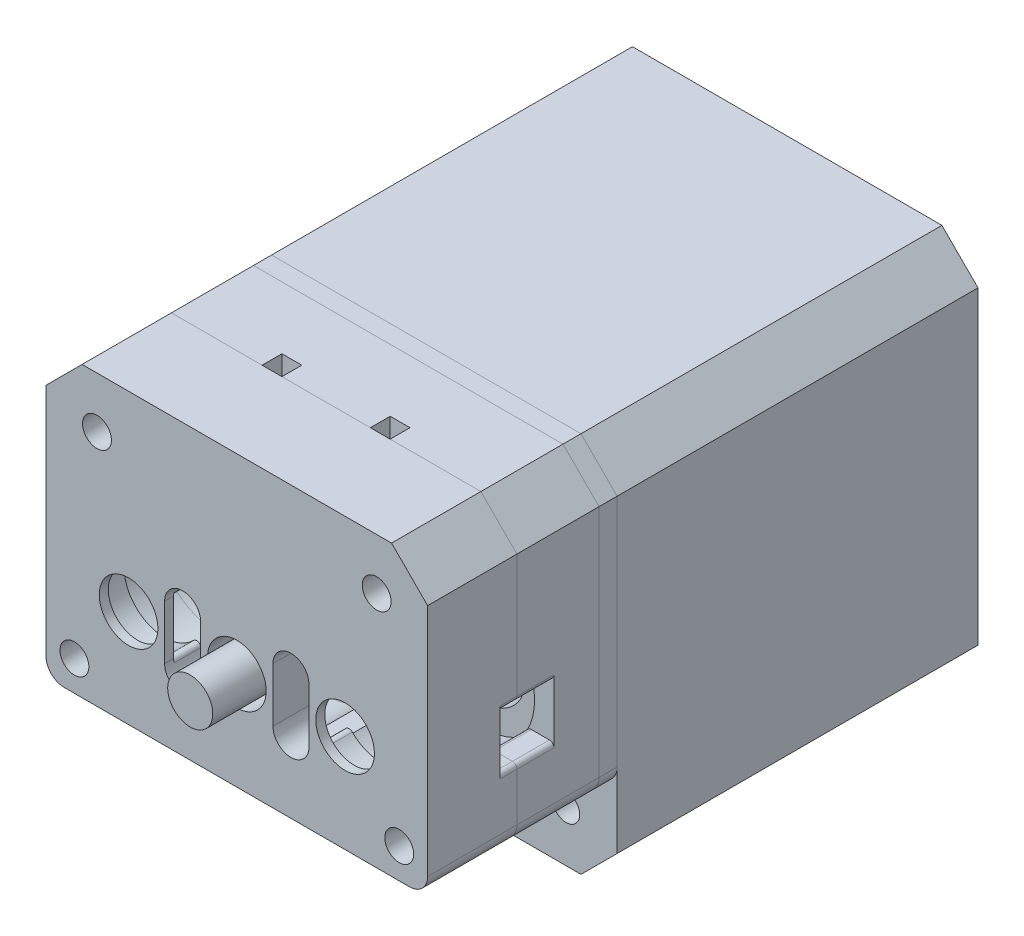
from build123d import *

# Parameters (mm, degrees)
SKETCH1_W                = 42.3
SKETCH1_H                = 42.3
BOSS_EXTRUDE1_DEPTH      = 40
CHAMFER1_SIZE            = 4
SKETCH3_R                = 1.5
CUT_EXTRUDE1_DEPTH       = 5
BOSS_EXTRUDE2_DEPTH      = 2
BOSS_EXTRUDE4_DEPTH      = 19
SKETCH6_R                = 2.5
BOSS_EXTRUDE3_DEPTH      = 19
SKETCH7_R                = 1.6
CUT_EXTRUDE2_DEPTH       = 68.938538401
SKETCH8_W                = 2.2
SKETCH8_H                = 2.2
CUT_EXTRUDE3_DEPTH       = 62.940394736
CUT_EXTRUDE4_DEPTH       = 68.938538401
SKETCH10_R               = 7
CUT_EXTRUDE5_DEPTH       = 68.938538401
CUT_EXTRUDE7_DEPTH       = 15.5
FILLET1_R                = 0.5
SKETCH14_R               = 3.25
CUT_EXTRUDE8_DEPTH       = 55.450849396
SKETCH17_R               = 1.6
CUT_EXTRUDE11_DEPTH      = 9.9
SKETCH47_R               = 1.25
CUT_EXTRUDE27_DEPTH      = 60.210260935
SURFACE_EXTRUDE2_1_BACK  = 25
SURFACE_EXTRUDE2_1_DEPTH = 25
CUT_EXTRUDE24_DEPTH      = 3
SKETCH36_W               = 12
SKETCH36_H               = 7.6
SKETCH36_W_2             = 2.2
SKETCH36_H_2             = 2.2
BOSS_EXTRUDE9_DEPTH      = 2
SKETCH39_W               = 2.2
SKETCH39_H               = 2.2
BOSS_EXTRUDE10_DEPTH     = 2
SKETCH37_R               = 7
CUT_EXTRUDE20_DEPTH      = 55.450849396
SKETCH38_R               = 7
CUT_EXTRUDE21_DEPTH      = 7.6
FILLET10_R               = 1
FILLET11_R               = 0.5
SKETCH40_W               = 6
SKETCH40_H               = 6
CUT_EXTRUDE22_DEPTH      = 5
BOSS_EXTRUDE12_DEPTH     = 7.9
FILLET12_R               = 0.5
BOSS_EXTRUDE13_START     = -4
BOSS_EXTRUDE13_OUTLINE_R = 3.25
BOSS_EXTRUDE13_DEPTH     = 4
SKETCH45_R               = 4.5
CUT_EXTRUDE25_DEPTH      = 3
FILLET14_R               = 0.5
SKETCH46_R               = 3.25
CUT_EXTRUDE26_DEPTH      = 68.938538401
FILLET15_R               = 2
SKETCH49_R               = 1.5
CUT_EXTRUDE28_DEPTH      = 9.1
SKETCH50_R               = 1.6
BOSS_EXTRUDE14_DEPTH     = 2
FILLET16_R               = 0.5
SKETCH51_R               = 1.4
BOSS_EXTRUDE15_DEPTH     = 3


with BuildPart() as part:
    # Sketch1 → Boss-Extrude1 (new body)
    with BuildSketch(Plane.XY):
        Rectangle(SKETCH1_W, SKETCH1_H)
    extrude(amount=-BOSS_EXTRUDE1_DEPTH)

    # Sketch2 → Revolve1 (revolve)
    with BuildSketch(Plane(origin=(0, 0, 0), x_dir=(1, 0, 0), z_dir=(0, 1, 0)), mode=Mode.PRIVATE) as revolve1_sk:
        Polygon((11, -2), (2.5, -2), (2.5, -26.163724733), (0, -26.163724733), (0, 0), (11, 0), align=None)
    revolve(revolve1_sk.sketch.rotate(Axis((0, 0, 0), (0, 0, 1)), 180), axis=Axis((0, 0, 0), (0, 0, 1)))

    # Chamfer1
    chamfer1_edges = [part.edges().sort_by_distance(p)[0] for p in [
        (-21.15, 21.15, -20),
        (21.15, 21.15, -20),
        (21.15, -21.15, -20),
        (-21.15, -21.15, -20),
    ]]
    chamfer(chamfer1_edges, length=CHAMFER1_SIZE)

    # Sketch3 → Cut-Extrude1 (cut)
    with BuildSketch(Plane.XY):
        with Locations((-15.5, 15.5)):
            Circle(SKETCH3_R)
        with Locations((15.5, 15.5)):
            Circle(SKETCH3_R)
        with Locations((15.5, -15.5)):
            Circle(SKETCH3_R)
        with Locations((-15.5, -15.5)):
            Circle(SKETCH3_R)
    extrude(amount=-CUT_EXTRUDE1_DEPTH, mode=Mode.SUBTRACT)


with BuildPart() as body_2:
    # Sketch5 → Boss-Extrude2 (new body)
    with BuildSketch(Plane.XY):
        with BuildLine():
            Line((-21.15, -10.85), (-2.342541355, -10.85))
            ThreePointArc((-2.342541355, -10.85), (0, 11.1), (2.342541355, -10.85))
            Line((2.342541355, -10.85), (21.15, -10.85))
            Line((21.15, -10.85), (21.15, 17.15))
            Line((21.15, 17.15), (17.15, 21.15))
            Line((17.15, 21.15), (-17.15, 21.15))
            Line((-17.15, 21.15), (-21.15, 17.15))
            Line((-21.15, 17.15), (-21.15, -10.85))
        make_face()
    extrude(amount=BOSS_EXTRUDE2_DEPTH)


with BuildPart() as body_3:
    # Sketch20 → Boss-Extrude4 (new body)
    with BuildSketch(Plane.XY.offset(2)):
        with BuildLine():
            Line((21.15, 17.15), (17.15, 21.15))
            Line((17.15, 21.15), (-17.15, 21.15))
            Line((-17.15, 21.15), (-21.15, 17.15))
            Line((-21.15, 17.15), (-21.15, -10.85))
            Line((-21.15, -10.85), (-2.342541355, -10.85))
            ThreePointArc((-2.342541355, -10.85), (0, 11.1), (2.342541355, -10.85))
            Line((2.342541355, -10.85), (21.15, -10.85))
            Line((21.15, -10.85), (21.15, 17.15))
        make_face()
    extrude(amount=BOSS_EXTRUDE4_DEPTH)

    # Sketch6 → Boss-Extrude3 (add)
    with BuildSketch(Plane.XY.offset(21)):
        with BuildLine():
            Line((-2.342541355, -10.85), (2.342541355, -10.85))
            ThreePointArc((2.342541355, -10.85), (0, 11.1), (-2.342541355, -10.85))
        make_face()
        with Locations(Location((0, 0, 0), (0, 0, 180))):
            Circle(SKETCH6_R, mode=Mode.SUBTRACT)
    extrude(amount=-BOSS_EXTRUDE3_DEPTH)


with BuildPart() as cut_extrude2_tool:
    # Sketch7 → Cut-Extrude2 (new, through all)
    with BuildSketch(Plane.XY.offset(21)):
        with Locations((15.5, 15.5)):
            Circle(SKETCH7_R)
    extrude(amount=-CUT_EXTRUDE2_DEPTH)


with BuildPart() as body_2_1:
    add(body_2.part)

    # Cut-Extrude2: cut by cut_extrude2_tool
    add(cut_extrude2_tool.part, mode=Mode.SUBTRACT)


with BuildPart() as body_3_1:
    add(body_3.part)

    # Cut-Extrude2: cut by cut_extrude2_tool
    add(cut_extrude2_tool.part, mode=Mode.SUBTRACT)

    # Sketch8 → Cut-Extrude3 (cut, through all)
    with BuildSketch(Plane(origin=(0, 21.15, 0), x_dir=(1, 0, 0), z_dir=(0, 1, 0))):
        with Locations((6, -10)):
            Rectangle(SKETCH8_W, SKETCH8_H)
    extrude(amount=-CUT_EXTRUDE3_DEPTH, mode=Mode.SUBTRACT)


with BuildPart() as cut_extrude4_tool:
    # Sketch9 → Cut-Extrude4 (new, through all)
    with BuildSketch(Plane.XY.offset(21)):
        Polygon((0, 21.15), (0, -10.85), (-21.15, -10.85), (-21.15, 17.15), (-17.15, 21.15), align=None)
    extrude(amount=-CUT_EXTRUDE4_DEPTH)


with BuildPart() as body_2_2:
    add(body_2_1.part)

    # Cut-Extrude4: cut by cut_extrude4_tool
    add(cut_extrude4_tool.part, mode=Mode.SUBTRACT)

    # Fillet1
    fillet1_edges = [body_2_2.edges().sort_by_distance(p)[0] for p in [
        (2.342541355, -10.85, 1),
    ]]
    fillet(fillet1_edges, radius=FILLET1_R)


with BuildPart() as body_3_2:
    add(body_3_1.part)

    # Cut-Extrude4: cut by cut_extrude4_tool
    add(cut_extrude4_tool.part, mode=Mode.SUBTRACT)

    # Sketch10 → Cut-Extrude5 (cut, through all)
    with BuildSketch(Plane.XY.offset(21)):
        Circle(SKETCH10_R)
    extrude(amount=-CUT_EXTRUDE5_DEPTH, mode=Mode.SUBTRACT)

    # Sketch13 → Cut-Extrude7 (cut)
    with BuildSketch(Plane.XY.offset(21)):
        with BuildLine():
            Line((12, 7), (0, 7))
            ThreePointArc((0, 7), (7, 0), (0, -7))
            Line((0, -7), (12, -7))
            ThreePointArc((12, -7), (19, 0), (12, 7))
        make_face()
    extrude(amount=-CUT_EXTRUDE7_DEPTH, mode=Mode.SUBTRACT)

    # Sketch14 → Cut-Extrude8 (cut, through all)
    with BuildSketch(Plane.XY.offset(5.5)):
        with Locations((12, 0)):
            Circle(SKETCH14_R)
    extrude(amount=-CUT_EXTRUDE8_DEPTH, mode=Mode.SUBTRACT)

    # Sketch17 → Cut-Extrude11 (cut)
    with BuildSketch(Plane(origin=(0, 0, 21), x_dir=(-1, 0, 0), z_dir=(0, 0, -1))):
        with Locations(Location((-18, -7.5, 0), (0, 0, 180))):
            Circle(SKETCH17_R)
    extrude(amount=CUT_EXTRUDE11_DEPTH, mode=Mode.SUBTRACT)

    # Sketch47 → Cut-Extrude27 (cut, through all)
    with BuildSketch(Plane.XY.offset(11.1)):
        with Locations((18, -7.5)):
            Circle(SKETCH47_R)
    extrude(amount=-CUT_EXTRUDE27_DEPTH, mode=Mode.SUBTRACT)

    # Combine1: union body 2
    add(body_2_2.part)

    # SurfaceCut1: cut with a surface, the side it looks to stays
    # Surface-Extrude2: a surface, the sketch's curves swept straight by 25 mm
    with BuildLine(Plane.ZY.offset(-SURFACE_EXTRUDE2_1_BACK), mode=Mode.PRIVATE) as surface_extrude2_1_path:
        Line((2, 21.15), (2, -10.85))
    surface_extrude2_1 = Shell.extrude(surface_extrude2_1_path.wire(), (-1 * SURFACE_EXTRUDE2_1_DEPTH, 0 * SURFACE_EXTRUDE2_1_DEPTH, 0 * SURFACE_EXTRUDE2_1_DEPTH))
    split(bisect_by=surface_extrude2_1, keep=Keep.TOP)

    # Sketch41 → Cut-Extrude24 (cut)
    with BuildSketch(Plane.XY.offset(5.5)):
        with BuildLine():
            Line((7.968871126, 2), (6.708203932, 2))
            ThreePointArc((6.708203932, 2), (7, 0), (6.708203932, -2))
            Line((6.708203932, -2), (7.968871126, -2))
            ThreePointArc((7.968871126, -2), (16.5, 0), (7.968871126, 2))
        make_face()
    extrude(amount=-CUT_EXTRUDE24_DEPTH, mode=Mode.SUBTRACT)

    # Sketch36 → Boss-Extrude9 (add)
    with BuildSketch(Plane(origin=(0, -7, 0), x_dir=(1, 0, 0), z_dir=(0, 1, 0))):
        with Locations((6, -9.3)):
            Rectangle(SKETCH36_W, SKETCH36_H)
        with Locations((6, -10)):
            Rectangle(SKETCH36_W_2, SKETCH36_H_2, mode=Mode.SUBTRACT)
    extrude(amount=BOSS_EXTRUDE9_DEPTH)

    # Sketch39 → Boss-Extrude10 (add)
    with BuildSketch(Plane.XZ.offset(-7)):
        Polygon((12, 5.5), (12, 13.1), (0, 13.1), (0, 5.5), (4.898979486, 5.5), align=None)
        with Locations((6, 10)):
            Rectangle(SKETCH39_W, SKETCH39_H, mode=Mode.SUBTRACT)
    extrude(amount=BOSS_EXTRUDE10_DEPTH)

    # Sketch37 → Cut-Extrude20 (cut, through all)
    with BuildSketch(Plane(origin=(0, 0, 5.5), x_dir=(-1, 0, 0), z_dir=(0, 0, -1))):
        Circle(SKETCH37_R)
    extrude(amount=-CUT_EXTRUDE20_DEPTH, mode=Mode.SUBTRACT)

    # Sketch38 → Cut-Extrude21 (cut)
    with BuildSketch(Plane.XY.offset(13.1)):
        with Locations((12, 0)):
            Circle(SKETCH38_R)
    extrude(amount=-CUT_EXTRUDE21_DEPTH, mode=Mode.SUBTRACT)

    # Fillet10
    # the kernel refuses this fillet: 1 mm, written as the material it takes off along each edge
    with BuildSketch(Plane(origin=(4.9, -5, 8.9), x_dir=(-1, 0, 0), z_dir=(0, 0, 1)), Plane(origin=(7.1, -5, 11.1), x_dir=(1, 0, 0), z_dir=(0, 0, -1)), Plane(origin=(7.1, -5, 8.9), x_dir=(0, 0, -1), z_dir=(-1, 0, 0))) as fillet10_piece_1:
        with BuildLine():
            CenterArc((FILLET10_R, FILLET10_R), FILLET10_R, 180, 90)
            Line((0, FILLET10_R), (0, 0))
            Line((0, 0), (FILLET10_R, 0))
        make_face()
    extrude(amount=2.2, mode=Mode.SUBTRACT)
    with BuildSketch(Plane(origin=(4.9, -5, 11.1), x_dir=(0, -1, 0), z_dir=(1, 0, 0))) as fillet10_piece_2:
        with BuildLine():
            CenterArc((FILLET10_R, -FILLET10_R), FILLET10_R, 90, 90)
            Line((0, -FILLET10_R), (0, 0))
            Line((0, 0), (FILLET10_R, 0))
        make_face()
    extrude(amount=2.2, mode=Mode.SUBTRACT)
    with BuildSketch(Plane(origin=(4.9, -5, 6.4), x_dir=(-1, 0, 0), z_dir=(0, 0, 1))) as fillet10_piece_3a_section:
        with BuildLine():
            CenterArc((FILLET10_R, FILLET10_R), FILLET10_R, 180, 90)
            Line((0, FILLET10_R), (0, 0))
            Line((0, 0), (FILLET10_R, 0))
        make_face()
    fillet10_piece_3a = extrude(amount=4.7, mode=Mode.PRIVATE)
    fillet10_piece_3a = fillet10_piece_3a - Plane(origin=(0, 0, 6.4), x_dir=(1, 0, 0), z_dir=(0, 0, 1)) * Cylinder(7, 14, mode=Mode.PRIVATE)
    fillet10_piece_3a = split(fillet10_piece_3a, bisect_by=Plane(origin=(4.9, -5, 8.9), z_dir=(0, 0, -1)), keep=Keep.TOP, mode=Mode.PRIVATE)
    with BuildSketch(Plane(origin=(7.1, -5, 8.9), x_dir=(0, 0, -1), z_dir=(-1, 0, 0))) as fillet10_piece_3b_section:
        with BuildLine():
            CenterArc((FILLET10_R, FILLET10_R), FILLET10_R, 180, 90)
            Line((0, FILLET10_R), (0, 0))
            Line((0, 0), (FILLET10_R, 0))
        make_face()
    fillet10_piece_3b = extrude(amount=4.7, mode=Mode.PRIVATE)
    fillet10_piece_3b = fillet10_piece_3b - Plane(origin=(0, 0, 8.9), x_dir=(1, 0, 0), z_dir=(0, 0, 1)) * Cylinder(7, 14, mode=Mode.PRIVATE)
    fillet10_piece_3b = split(fillet10_piece_3b, bisect_by=Plane(origin=(4.9, -5, 8.9), z_dir=(-1, 0, 0)), keep=Keep.TOP, mode=Mode.PRIVATE)
    fillet10_piece_3 = fillet10_piece_3a & fillet10_piece_3b
    add(fillet10_piece_3, mode=Mode.SUBTRACT)
    with BuildSketch(Plane(origin=(2.4, -5, 11.1), x_dir=(0, -1, 0), z_dir=(1, 0, 0))) as fillet10_piece_4a_section:
        with BuildLine():
            CenterArc((FILLET10_R, -FILLET10_R), FILLET10_R, 90, 90)
            Line((0, -FILLET10_R), (0, 0))
            Line((0, 0), (FILLET10_R, 0))
        make_face()
    fillet10_piece_4a = extrude(amount=4.7, mode=Mode.PRIVATE)
    fillet10_piece_4a = fillet10_piece_4a - Plane(origin=(0, 0, 11.1), x_dir=(1, 0, 0), z_dir=(0, 0, 1)) * Cylinder(7, 14, mode=Mode.PRIVATE)
    fillet10_piece_4a = split(fillet10_piece_4a, bisect_by=Plane(origin=(4.9, -5, 11.1), z_dir=(-1, 0, 0)), keep=Keep.TOP, mode=Mode.PRIVATE)
    with BuildSketch(Plane(origin=(4.9, -5, 8.9), x_dir=(-1, 0, 0), z_dir=(0, 0, 1))) as fillet10_piece_4b_section:
        with BuildLine():
            CenterArc((FILLET10_R, FILLET10_R), FILLET10_R, 180, 90)
            Line((0, FILLET10_R), (0, 0))
            Line((0, 0), (FILLET10_R, 0))
        make_face()
    fillet10_piece_4b = extrude(amount=4.7, mode=Mode.PRIVATE)
    fillet10_piece_4b = split(fillet10_piece_4b, bisect_by=Plane(origin=(4.9, -5, 11.1), z_dir=(0, 0, 1)), keep=Keep.TOP, mode=Mode.PRIVATE)
    fillet10_piece_4b = split(fillet10_piece_4b, bisect_by=Plane(origin=(4.9, -5, 13.1), z_dir=(0, 0, -1)), keep=Keep.TOP, mode=Mode.PRIVATE)
    fillet10_piece_4b = fillet10_piece_4b - Plane(origin=(0, 0, 8.9), x_dir=(1, 0, 0), z_dir=(0, 0, 1)) * Cylinder(7, 14, mode=Mode.PRIVATE)
    fillet10_piece_4 = fillet10_piece_4a & fillet10_piece_4b
    add(fillet10_piece_4, mode=Mode.SUBTRACT)
    with BuildSketch(Plane(origin=(4.9, -5, 11.1), x_dir=(0, -1, 0), z_dir=(1, 0, 0))) as fillet10_piece_5a_section:
        with BuildLine():
            CenterArc((FILLET10_R, -FILLET10_R), FILLET10_R, 90, 90)
            Line((0, -FILLET10_R), (0, 0))
            Line((0, 0), (FILLET10_R, 0))
        make_face()
    fillet10_piece_5a = extrude(amount=4.7, mode=Mode.PRIVATE)
    fillet10_piece_5a = fillet10_piece_5a - Plane(origin=(12, 0, 11.1), x_dir=(0, -1, 0), z_dir=(0, 0, 1)) * Cylinder(7, 14, mode=Mode.PRIVATE)
    fillet10_piece_5a = split(fillet10_piece_5a, bisect_by=Plane(origin=(7.1, -5, 11.1), z_dir=(1, 0, 0)), keep=Keep.TOP, mode=Mode.PRIVATE)
    with BuildSketch(Plane(origin=(7.1, -5, 13.6), x_dir=(1, 0, 0), z_dir=(0, 0, -1))) as fillet10_piece_5b_section:
        with BuildLine():
            CenterArc((FILLET10_R, FILLET10_R), FILLET10_R, 180, 90)
            Line((0, FILLET10_R), (0, 0))
            Line((0, 0), (FILLET10_R, 0))
        make_face()
    fillet10_piece_5b = extrude(amount=4.7, mode=Mode.PRIVATE)
    fillet10_piece_5b = split(fillet10_piece_5b, bisect_by=Plane(origin=(7.1, -5, 11.1), z_dir=(0, 0, 1)), keep=Keep.TOP, mode=Mode.PRIVATE)
    fillet10_piece_5b = split(fillet10_piece_5b, bisect_by=Plane(origin=(7.1, -5, 13.1), z_dir=(0, 0, -1)), keep=Keep.TOP, mode=Mode.PRIVATE)
    fillet10_piece_5b = fillet10_piece_5b - Plane(origin=(12, 0, 13.6), x_dir=(0, -1, 0), z_dir=(0, 0, 1)) * Cylinder(7, 14, mode=Mode.PRIVATE)
    fillet10_piece_5 = fillet10_piece_5a & fillet10_piece_5b
    add(fillet10_piece_5, mode=Mode.SUBTRACT)
    with BuildSketch(Plane(origin=(9.6, -5, 8.9), x_dir=(0, 0, -1), z_dir=(-1, 0, 0))) as fillet10_piece_6a_section:
        with BuildLine():
            CenterArc((FILLET10_R, FILLET10_R), FILLET10_R, 180, 90)
            Line((0, FILLET10_R), (0, 0))
            Line((0, 0), (FILLET10_R, 0))
        make_face()
    fillet10_piece_6a = extrude(amount=4.7, mode=Mode.PRIVATE)
    fillet10_piece_6a = fillet10_piece_6a - Plane(origin=(12, 0, 8.9), x_dir=(0, -1, 0), z_dir=(0, 0, 1)) * Cylinder(7, 14, mode=Mode.PRIVATE)
    fillet10_piece_6a = split(fillet10_piece_6a, bisect_by=Plane(origin=(7.1, -5, 8.9), z_dir=(1, 0, 0)), keep=Keep.TOP, mode=Mode.PRIVATE)
    with BuildSketch(Plane(origin=(7.1, -5, 11.1), x_dir=(1, 0, 0), z_dir=(0, 0, -1))) as fillet10_piece_6b_section:
        with BuildLine():
            CenterArc((FILLET10_R, FILLET10_R), FILLET10_R, 180, 90)
            Line((0, FILLET10_R), (0, 0))
            Line((0, 0), (FILLET10_R, 0))
        make_face()
    fillet10_piece_6b = extrude(amount=4.7, mode=Mode.PRIVATE)
    fillet10_piece_6b = fillet10_piece_6b - Plane(origin=(12, 0, 11.1), x_dir=(0, -1, 0), z_dir=(0, 0, 1)) * Cylinder(7, 14, mode=Mode.PRIVATE)
    fillet10_piece_6b = split(fillet10_piece_6b, bisect_by=Plane(origin=(7.1, -5, 8.9), z_dir=(0, 0, -1)), keep=Keep.TOP, mode=Mode.PRIVATE)
    fillet10_piece_6 = fillet10_piece_6a & fillet10_piece_6b
    add(fillet10_piece_6, mode=Mode.SUBTRACT)

    # Fillet11
    # the kernel refuses this fillet: 0.5 mm, written as the material it takes off along each edge
    with BuildSketch(Plane(origin=(7.1, 5, 8.9), x_dir=(1, 0, 0), z_dir=(0, 0, 1)), Plane(origin=(7.1, 5, 11.1), x_dir=(0, 0, 1), z_dir=(-1, 0, 0)), Plane(origin=(4.9, 5, 11.1), x_dir=(-1, 0, 0), z_dir=(0, 0, -1)), Plane(origin=(4.9, 5, 8.9), x_dir=(0, 0, -1), z_dir=(1, 0, 0))) as fillet11_piece_1:
        with BuildLine():
            CenterArc((FILLET11_R, FILLET11_R), FILLET11_R, 180, 90)
            Line((0, FILLET11_R), (0, 0))
            Line((0, 0), (FILLET11_R, 0))
        make_face()
    extrude(amount=2.2, mode=Mode.SUBTRACT)
    with BuildSketch(Plane(origin=(7.1, 5, 7.65), x_dir=(1, 0, 0), z_dir=(0, 0, 1))) as fillet11_piece_2a_section:
        with BuildLine():
            CenterArc((FILLET11_R, FILLET11_R), FILLET11_R, 180, 90)
            Line((0, FILLET11_R), (0, 0))
            Line((0, 0), (FILLET11_R, 0))
        make_face()
    fillet11_piece_2a = extrude(amount=3.45, mode=Mode.PRIVATE)
    fillet11_piece_2a = split(fillet11_piece_2a, bisect_by=Plane(origin=(7.1, 5, 8.9), z_dir=(0, 0, -1)), keep=Keep.TOP, mode=Mode.PRIVATE)
    fillet11_piece_2a = fillet11_piece_2a - Plane(origin=(12, 0, 7.65), x_dir=(0, -1, 0), z_dir=(0, 0, 1)) * Cylinder(7, 9, mode=Mode.PRIVATE)
    with BuildSketch(Plane(origin=(4.9, 5, 8.9), x_dir=(0, 0, -1), z_dir=(1, 0, 0))) as fillet11_piece_2b_section:
        with BuildLine():
            CenterArc((FILLET11_R, FILLET11_R), FILLET11_R, 180, 90)
            Line((0, FILLET11_R), (0, 0))
            Line((0, 0), (FILLET11_R, 0))
        make_face()
    fillet11_piece_2b = extrude(amount=3.45, mode=Mode.PRIVATE)
    fillet11_piece_2b = split(fillet11_piece_2b, bisect_by=Plane(origin=(7.1, 5, 8.9), z_dir=(1, 0, 0)), keep=Keep.TOP, mode=Mode.PRIVATE)
    fillet11_piece_2b = fillet11_piece_2b - Plane(origin=(12, 0, 8.9), x_dir=(0, -1, 0), z_dir=(0, 0, 1)) * Cylinder(7, 9, mode=Mode.PRIVATE)
    fillet11_piece_2 = fillet11_piece_2a & fillet11_piece_2b
    add(fillet11_piece_2, mode=Mode.SUBTRACT)
    with BuildSketch(Plane(origin=(7.1, 5, 8.9), x_dir=(1, 0, 0), z_dir=(0, 0, 1))) as fillet11_piece_3a_section:
        with BuildLine():
            CenterArc((FILLET11_R, FILLET11_R), FILLET11_R, 180, 90)
            Line((0, FILLET11_R), (0, 0))
            Line((0, 0), (FILLET11_R, 0))
        make_face()
    fillet11_piece_3a = extrude(amount=3.45, mode=Mode.PRIVATE)
    fillet11_piece_3a = split(fillet11_piece_3a, bisect_by=Plane(origin=(7.1, 5, 11.1), z_dir=(0, 0, 1)), keep=Keep.TOP, mode=Mode.PRIVATE)
    fillet11_piece_3a = fillet11_piece_3a - Plane(origin=(12, 0, 8.9), x_dir=(0, -1, 0), z_dir=(0, 0, 1)) * Cylinder(7, 9, mode=Mode.PRIVATE)
    with BuildSketch(Plane(origin=(8.35, 5, 11.1), x_dir=(0, 0, 1), z_dir=(-1, 0, 0))) as fillet11_piece_3b_section:
        with BuildLine():
            CenterArc((FILLET11_R, FILLET11_R), FILLET11_R, 180, 90)
            Line((0, FILLET11_R), (0, 0))
            Line((0, 0), (FILLET11_R, 0))
        make_face()
    fillet11_piece_3b = extrude(amount=3.45, mode=Mode.PRIVATE)
    fillet11_piece_3b = split(fillet11_piece_3b, bisect_by=Plane(origin=(7.1, 5, 11.1), z_dir=(1, 0, 0)), keep=Keep.TOP, mode=Mode.PRIVATE)
    fillet11_piece_3b = fillet11_piece_3b - Plane(origin=(12, 0, 11.1), x_dir=(0, -1, 0), z_dir=(0, 0, 1)) * Cylinder(7, 9, mode=Mode.PRIVATE)
    fillet11_piece_3 = fillet11_piece_3a & fillet11_piece_3b
    add(fillet11_piece_3, mode=Mode.SUBTRACT)
    with BuildSketch(Plane(origin=(7.1, 5, 11.1), x_dir=(0, 0, 1), z_dir=(-1, 0, 0))) as fillet11_piece_4a_section:
        with BuildLine():
            CenterArc((FILLET11_R, FILLET11_R), FILLET11_R, 180, 90)
            Line((0, FILLET11_R), (0, 0))
            Line((0, 0), (FILLET11_R, 0))
        make_face()
    fillet11_piece_4a = extrude(amount=3.45, mode=Mode.PRIVATE)
    fillet11_piece_4a = split(fillet11_piece_4a, bisect_by=Plane(origin=(4.9, 5, 11.1), z_dir=(-1, 0, 0)), keep=Keep.TOP, mode=Mode.PRIVATE)
    fillet11_piece_4a = fillet11_piece_4a - Plane(origin=(0, 0, 11.1), x_dir=(1, 0, 0), z_dir=(0, 0, 1)) * Cylinder(7, 9, mode=Mode.PRIVATE)
    with BuildSketch(Plane(origin=(4.9, 5, 12.35), x_dir=(-1, 0, 0), z_dir=(0, 0, -1))) as fillet11_piece_4b_section:
        with BuildLine():
            CenterArc((FILLET11_R, FILLET11_R), FILLET11_R, 180, 90)
            Line((0, FILLET11_R), (0, 0))
            Line((0, 0), (FILLET11_R, 0))
        make_face()
    fillet11_piece_4b = extrude(amount=3.45, mode=Mode.PRIVATE)
    fillet11_piece_4b = split(fillet11_piece_4b, bisect_by=Plane(origin=(4.9, 5, 11.1), z_dir=(0, 0, 1)), keep=Keep.TOP, mode=Mode.PRIVATE)
    fillet11_piece_4b = fillet11_piece_4b - Plane(origin=(0, 0, 12.35), x_dir=(1, 0, 0), z_dir=(0, 0, 1)) * Cylinder(7, 9, mode=Mode.PRIVATE)
    fillet11_piece_4 = fillet11_piece_4a & fillet11_piece_4b
    add(fillet11_piece_4, mode=Mode.SUBTRACT)
    with BuildSketch(Plane(origin=(3.65, 5, 8.9), x_dir=(0, 0, -1), z_dir=(1, 0, 0))) as fillet11_piece_5a_section:
        with BuildLine():
            CenterArc((FILLET11_R, FILLET11_R), FILLET11_R, 180, 90)
            Line((0, FILLET11_R), (0, 0))
            Line((0, 0), (FILLET11_R, 0))
        make_face()
    fillet11_piece_5a = extrude(amount=3.45, mode=Mode.PRIVATE)
    fillet11_piece_5a = split(fillet11_piece_5a, bisect_by=Plane(origin=(4.9, 5, 8.9), z_dir=(-1, 0, 0)), keep=Keep.TOP, mode=Mode.PRIVATE)
    fillet11_piece_5a = fillet11_piece_5a - Plane(origin=(0, 0, 8.9), x_dir=(1, 0, 0), z_dir=(0, 0, 1)) * Cylinder(7, 9, mode=Mode.PRIVATE)
    with BuildSketch(Plane(origin=(4.9, 5, 11.1), x_dir=(-1, 0, 0), z_dir=(0, 0, -1))) as fillet11_piece_5b_section:
        with BuildLine():
            CenterArc((FILLET11_R, FILLET11_R), FILLET11_R, 180, 90)
            Line((0, FILLET11_R), (0, 0))
            Line((0, 0), (FILLET11_R, 0))
        make_face()
    fillet11_piece_5b = extrude(amount=3.45, mode=Mode.PRIVATE)
    fillet11_piece_5b = split(fillet11_piece_5b, bisect_by=Plane(origin=(4.9, 5, 8.9), z_dir=(0, 0, -1)), keep=Keep.TOP, mode=Mode.PRIVATE)
    fillet11_piece_5b = fillet11_piece_5b - Plane(origin=(0, 0, 11.1), x_dir=(1, 0, 0), z_dir=(0, 0, 1)) * Cylinder(7, 9, mode=Mode.PRIVATE)
    fillet11_piece_5 = fillet11_piece_5a & fillet11_piece_5b
    add(fillet11_piece_5, mode=Mode.SUBTRACT)

    # Sketch40 → Cut-Extrude22 (cut)
    with BuildSketch(Plane(origin=(21.15, 0, 0), x_dir=(0, 0, -1), z_dir=(1, 0, 0))):
        with Locations((-10, 0)):
            Rectangle(SKETCH40_W, SKETCH40_H)
    extrude(amount=-CUT_EXTRUDE22_DEPTH, mode=Mode.SUBTRACT)

    # Sketch43 → Boss-Extrude12 (add)
    with BuildSketch(Plane.XY.offset(13.1)):
        with BuildLine():
            Line((0, -7), (12, -7))
            ThreePointArc((12, -7), (9.354248689, -6.480740698), (7.101020514, -5))
            Line((7.101020514, -5), (4.898979486, -5))
            ThreePointArc((4.898979486, -5), (2.645751311, -6.480740698), (0, -7))
        make_face()
        with BuildLine():
            Line((4.898979486, 5), (7.101020514, 5))
            ThreePointArc((7.101020514, 5), (9.354248689, 6.480740698), (12, 7))
            Line((12, 7), (0, 7))
            ThreePointArc((0, 7), (2.645751311, 6.480740698), (4.898979486, 5))
        make_face()
    extrude(amount=BOSS_EXTRUDE12_DEPTH)

    # Fillet12
    fillet12_edges = [body_3_2.edges().sort_by_distance(p)[0] for p in [
        (7.968871126, 2, 4),
        (7.968871126, -2, 4),
        (6.708203932, -2, 4),
        (6.708203932, 2, 4),
        (18.32455532, -3, 10),
        (18.32455532, 3, 10),
        (21.15, -3, 10),
        (21.15, 3, 10),
    ]]
    fillet(fillet12_edges, radius=FILLET12_R)


with BuildPart() as boss_extrude13_tool:
    # Boss-Extrude13: read off the stored shape, not the designer's step
    # Boss-Extrude13 outline → Boss-Extrude13 (new body)
    # profile 1 of 2: a face of its own
    with BuildSketch(Plane.XY.offset(21).offset(BOSS_EXTRUDE13_START)):
        with BuildLine():
            Line((0, 7), (0, -7))
            ThreePointArc((0, -7), (2.645751311, -6.480740698), (4.898979486, -5))
            Line((4.898979486, -5), (6, -5))
            ThreePointArc((6, -5), (4.585786438, -4.414213562), (4, -3))
            Line((4, -3), (4, 3))
            ThreePointArc((4, 3), (4.585786438, 4.414213562), (6, 5))
            Line((6, 5), (4.898979486, 5))
            ThreePointArc((4.898979486, 5), (2.645751311, 6.480740698), (0, 7))
        make_face()
    # profile 2 of 2: a face of its own
    with BuildSketch(Plane.XY.offset(21).offset(BOSS_EXTRUDE13_START)):
        with BuildLine():
            ThreePointArc((8, -3), (7.414213562, -4.414213562), (6, -5))
            Line((6, -5), (7.101019843, -4.999999342))
            ThreePointArc((7.101019843, -4.999999342), (19, 3.235e-06), (7.101015222, 4.999994815))
            Line((7.101015222, 4.999994815), (6, 5))
            ThreePointArc((6, 5), (7.414213562, 4.414213562), (8, 3))
            Line((8, 3), (8, -3))
        make_face()
        with Locations((12, 0)):
            Circle(BOSS_EXTRUDE13_OUTLINE_R, mode=Mode.SUBTRACT)
    extrude(amount=BOSS_EXTRUDE13_DEPTH)


with BuildPart() as body_3_3:
    add(body_3_2.part)


with BuildPart() as body_3_4:
    # Boss-Extrude13: joined with boss_extrude13_tool
    add(body_3_3.part.fuse(boss_extrude13_tool.part, tol=0.00001))

    # Sketch45 → Cut-Extrude25 (cut)
    with BuildSketch(Plane(origin=(0, 0, 17), x_dir=(-1, 0, 0), z_dir=(0, 0, -1))):
        with Locations((-12, 0)):
            Circle(SKETCH45_R)
    extrude(amount=-CUT_EXTRUDE25_DEPTH, mode=Mode.SUBTRACT)

    # Fillet14
    # the kernel refuses this fillet: 0.5 mm, written as the material it takes off along each edge
    with BuildSketch(Plane(origin=(8, 2.061552813, 20), x_dir=(-0.03195376463589735, 0.9994893480801051, 0), z_dir=(0, 0, -1))) as fillet14_piece_1:
        with BuildLine():
            CenterArc((1.440394643, 0.492247944), FILLET14_R, 136.530604839, 123.367012954)
            Line((1.077523665, 0.836231451), (1.041236567, 0.870629802))
            ThreePointArc((1.041236567, 0.870629802), (0.539973493, 0.416554444), (-0.024314613, 0.043689811))
            Line((-0.024314613, 0.043689811), (0.001597688, -0.049974467))
            ThreePointArc((0.001597688, -0.049974467), (0.939565656, -0.019987547), (1.343920431, -0.049224794))
            Line((1.343920431, -0.049224794), (1.352690814, 0))
        make_face()
    extrude(amount=6.4098573, mode=Mode.SUBTRACT)
    with BuildSketch(Plane(origin=(8, -2.061552813, 20), x_dir=(-0.03195376463589732, -0.9994893480801051, 0), z_dir=(0, 0, -1))) as fillet14_piece_2:
        with BuildLine():
            CenterArc((1.440394643, -0.492247944), FILLET14_R, 100.102382207, 123.367012954)
            Line((1.077523665, -0.836231451), (1.041236567, -0.870629802))
            ThreePointArc((1.041236567, -0.870629802), (0.539973493, -0.416554444), (-0.024314613, -0.043689811))
            Line((-0.024314613, -0.043689811), (0.001597688, 0.049974467))
            ThreePointArc((0.001597688, 0.049974467), (0.939565656, 0.019987547), (1.343920431, 0.049224794))
            Line((1.343920431, 0.049224794), (1.352690814, 0))
        make_face()
    extrude(amount=6.4098573, mode=Mode.SUBTRACT)

    # Sketch46 → Cut-Extrude26 (cut, through all)
    with BuildSketch(Plane.XY.offset(21)):
        Circle(SKETCH46_R)
    extrude(amount=-CUT_EXTRUDE26_DEPTH, mode=Mode.SUBTRACT)

    # Fillet15
    fillet15_edges = [body_3_4.edges().sort_by_distance(p)[0] for p in [
        (21.15, -10.85, 11.5),
    ]]
    fillet(fillet15_edges, radius=FILLET15_R)

    # Sketch49 → Cut-Extrude28 (cut)
    with BuildSketch(Plane.XY.offset(2)):
        with Locations(Location((9.5, -8.75, 0), (0, 0, 180))):
            Circle(SKETCH49_R)
        with Locations(Location((9.5, 8.75, 0), (0, 0, 180))):
            Circle(SKETCH49_R)
    extrude(amount=CUT_EXTRUDE28_DEPTH, mode=Mode.SUBTRACT)

    # Mirror1: body 3 across plane


with BuildPart() as body_3_5:
    add(body_3_4.part)
    add(body_3_4.part.mirror(Plane(origin=(0, 21.15, -40), x_dir=(0, 0, 1), z_dir=(1, 0, 0))))


with BuildPart() as body_3_2_1:
    # Split1: read off the stored shape, not the designer's step
    # Split1: the piece on the far side of the plane
    add(body_3_5.part)
    split(bisect_by=Plane.XY.offset(11.1), keep=Keep.BOTTOM)


with BuildPart() as body_3_6:
    add(body_3_5.part)

    # Split1
    split(bisect_by=Plane.XY.offset(11.1), keep=Keep.TOP)


with BuildPart() as body_4:
    # Sketch50 → Boss-Extrude14 (new body)
    with BuildSketch(Plane.XY.offset(2)):
        with BuildLine():
            Line((1.810386699, -10.85), (19.15, -10.85))
            ThreePointArc((19.15, -10.85), (20.564213562, -10.264213562), (21.15, -8.85))
            Line((21.15, -8.85), (21.15, 17.15))
            Line((21.15, 17.15), (17.15, 21.15))
            Line((17.15, 21.15), (-17.15, 21.15))
            Line((-17.15, 21.15), (-21.15, 17.15))
            Line((-21.15, 17.15), (-21.15, -8.85))
            ThreePointArc((-21.15, -8.85), (-20.564213562, -10.264213562), (-19.15, -10.85))
            Line((-19.15, -10.85), (-1.810386699, -10.85))
            ThreePointArc((-1.810386699, -10.85), (0, 11), (1.810386699, -10.85))
        make_face()
        with Locations(Location((-15.5, 15.5, 0), (0, 0, 180))):
            Circle(SKETCH50_R, mode=Mode.SUBTRACT)
        with Locations((15.5, 15.5)):
            Circle(SKETCH50_R, mode=Mode.SUBTRACT)
    extrude(amount=-BOSS_EXTRUDE14_DEPTH)

    # Fillet16
    fillet16_edges = [body_4.edges().sort_by_distance(p)[0] for p in [
        (1.810386699, -10.85, 1),
        (-1.810386699, -10.85, 1),
    ]]
    fillet(fillet16_edges, radius=FILLET16_R)

    # Sketch51 → Boss-Extrude15 (add)
    with BuildSketch(Plane.XY.offset(2)):
        with Locations((-9.5, 8.75)):
            Circle(SKETCH51_R)
        with Locations((9.5, 8.75)):
            Circle(SKETCH51_R)
        with Locations((9.5, -8.75)):
            Circle(SKETCH51_R)
        with Locations((-9.5, -8.75)):
            Circle(SKETCH51_R)
    extrude(amount=BOSS_EXTRUDE15_DEPTH)


solid = Compound([part.part, body_3_2_1.part, body_3_6.part, body_4.part])
